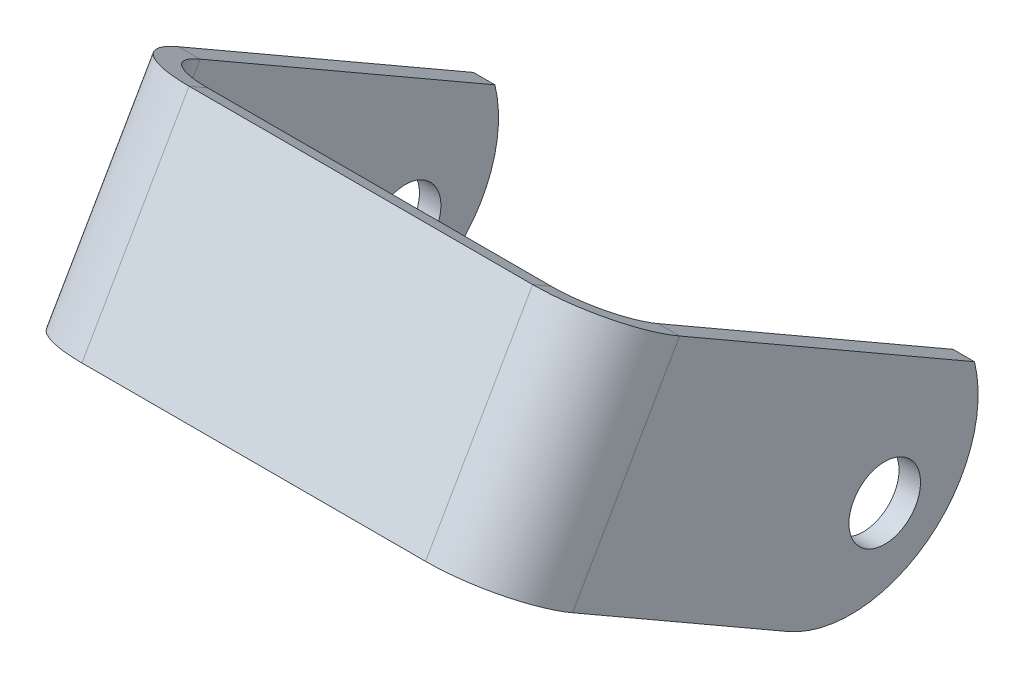
from build123d import *

# Parameters (mm, degrees)
BOSS_EXTRUDE1_DEPTH            = 16
BOSS_EXTRUDE1_DEPTH_BACK       = 16
EDGE_FLANGE1_STRIP_W           = 14
EDGE_FLANGE1_STRIP_H           = 1.5
EDGE_FLANGE1_STRIP_CUT_DEPTH   = 15
EDGE_FLANGE1_STRIP_2_W         = 14
EDGE_FLANGE1_STRIP_2_H         = 1.5
EDGE_FLANGE1_STRIP_CUT_2_DEPTH = 15
EDGE_FLANGE1_DEPTH             = 15
EDGE_FLANGE1_BEND_DEPTH        = 15
CUT_EXTRUDE1_DEPTH             = 70.261521918
CUT_EXTRUDE1_DEPTH_BACK        = 70.261521918
SKETCH12_R                     = 2.5


# Sheet-metal steps are written as plain solids
with BuildPart() as part:
    # Sketch1 → Boss-Extrude1 (new, two sides: drawn at the far end of the back side and taken through both)
    with BuildSketch(Plane(origin=(0, 0, 0), x_dir=(0, 0, -1), z_dir=(1, 0, 0)).offset(-BOSS_EXTRUDE1_DEPTH_BACK)):
        Polygon((13.736581906, 7.002159097), (21.218242798, 20.003110997), (22.518337988, 19.254944908), (15.036677096, 6.253993008), align=None)
    extrude(amount=BOSS_EXTRUDE1_DEPTH + BOSS_EXTRUDE1_DEPTH_BACK)

    # Edge-Flange1 strip (across the edge) → Edge-Flange1 strip cut (cut)
    with BuildSketch(Plane(origin=(16, 19.254944908, -22.518337988), x_dir=(-1, 0, 0), z_dir=(0, -0.8667301266485011, 0.498777392791487))):
        with Locations((-3, -0.75)):
            Rectangle(EDGE_FLANGE1_STRIP_W, EDGE_FLANGE1_STRIP_H)
    extrude(amount=EDGE_FLANGE1_STRIP_CUT_DEPTH, mode=Mode.SUBTRACT)

    # Edge-Flange1 strip 2 (across the edge) → Edge-Flange1 strip cut 2 (cut)
    with BuildSketch(Plane(origin=(-16, 6.253993008, -15.036677096), x_dir=(1, 0, 0), z_dir=(0, 0.8667301266485011, -0.498777392791487))):
        with Locations((-3, -0.75)):
            Rectangle(EDGE_FLANGE1_STRIP_2_W, EDGE_FLANGE1_STRIP_2_H)
    extrude(amount=EDGE_FLANGE1_STRIP_CUT_2_DEPTH, mode=Mode.SUBTRACT)

    # Edge-Flange1 section (across the edge) → Edge-Flange1 (add)
    with BuildSketch(Plane(origin=(16, 19.254944908, -22.518337988), x_dir=(-1, 0, 0), z_dir=(0, -0.8667301266485011, 0.498777392791487))):
        with BuildLine():
            Line((-1.5, 4), (-1.5, 39))
            Line((-1.5, 39), (0, 39))
            Line((0, 39), (0, 4))
            ThreePointArc((0, 4), (1.171572875, 1.171572875), (4, 0))
            Line((4, 0), (4, -1.5))
            ThreePointArc((4, -1.5), (0.110912703, 0.110912703), (-1.5, 4))
        make_face()
    extrude(amount=EDGE_FLANGE1_DEPTH)

    # Edge-Flange1 section 2 (across the edge) → Edge-Flange1 bend (add)
    with BuildSketch(Plane(origin=(-16, 6.253993008, -15.036677096), x_dir=(1, 0, 0), z_dir=(0, 0.8667301266485011, -0.498777392791487))):
        with BuildLine():
            Line((-1.5, 4), (-1.5, 39))
            Line((-1.5, 39), (0, 39))
            Line((0, 39), (0, 4))
            ThreePointArc((0, 4), (1.171572875, 1.171572875), (4, 0))
            Line((4, 0), (4, -1.5))
            ThreePointArc((4, -1.5), (0.110912703, 0.110912703), (-1.5, 4))
        make_face()
    extrude(amount=EDGE_FLANGE1_BEND_DEPTH)

    # Sketch12 → Cut-Extrude1 (cut, two sides: drawn at the far end of the back side and taken through both)
    with BuildSketch(Plane(origin=(17.5, 0, 0), x_dir=(0, 0, -1), z_dir=(1, 0, 0)).offset(-CUT_EXTRUDE1_DEPTH_BACK)):
        with Locations((40.312429407, 0)):
            Circle(SKETCH12_R)
        with BuildLine():
            Line((33.525218207, -4.385612156), (48.839152035, -13.198325311))
            Line((48.839152035, -13.198325311), (56.320812927, -0.197373411))
            Line((56.320812927, -0.197373411), (46.583424145, 5.406204035))
            ThreePointArc((46.583424145, 5.406204035), (43.281589749, -3.793536651), (33.525218207, -4.385612156))
        make_face()
    extrude(amount=CUT_EXTRUDE1_DEPTH + CUT_EXTRUDE1_DEPTH_BACK, mode=Mode.SUBTRACT)


solid = part.part
